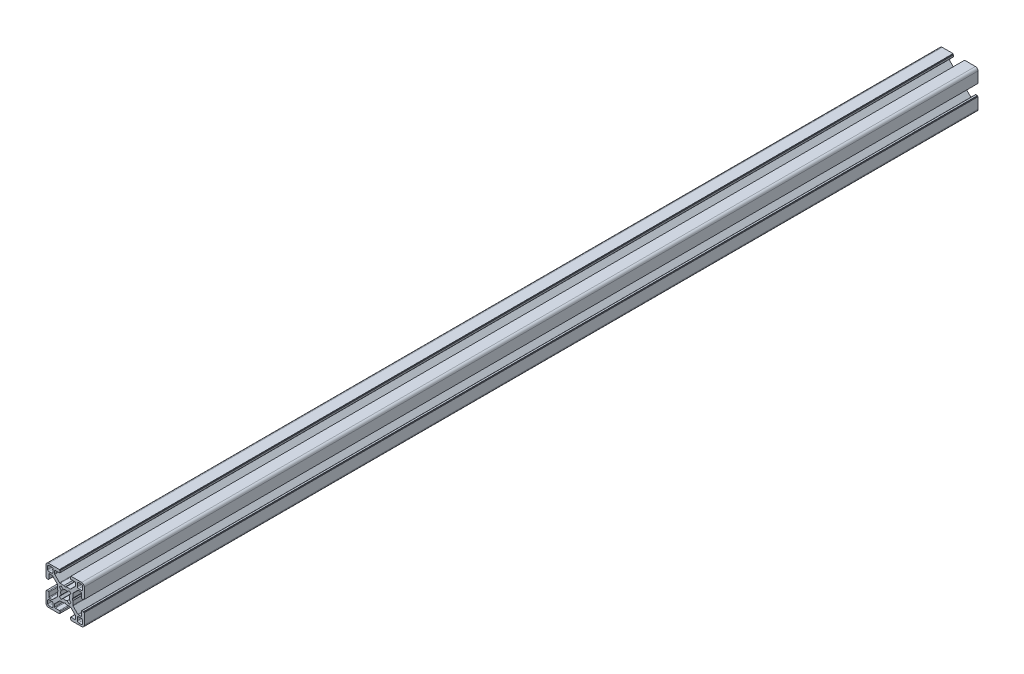
from build123d import *

# Parameters (mm, degrees)
BOSS_EXTRUDE1_DEPTH = 350
CIRPATTERN1_COUNT   = 4


with BuildPart() as part:
    # Sketch3 → Boss-Extrude1 (new, symmetric)
    with BuildSketch(Plane.XY):
        with BuildLine():
            Line((-4.503841895, 3.156803476), (-3.14772708, 1.530298739))
            ThreePointArc((-3.14772708, 1.530298739), (-3.410794979, 0.785160882), (-3.5, 0))
            Line((-3.5, 0), (-5.5, 0))
            Line((-5.5, 0), (-6, 0.866025404))
            Line((-6, 0.866025404), (-6, 3.996841995))
            ThreePointArc((-6, 3.996841995), (-6.038060234, 4.188183711), (-6.146446609, 4.350395385))
            Line((-6.146446609, 4.350395385), (-9.917104615, 8.121053391))
            ThreePointArc((-9.917104615, 8.121053391), (-10.079316289, 8.229439766), (-10.270658005, 8.2675))
            Line((-10.270658005, 8.2675), (-12.29, 8.2675))
            ThreePointArc((-12.29, 8.2675), (-12.643553391, 8.121053391), (-12.79, 7.7675))
            Line((-12.79, 7.7675), (-12.79, 4.5))
            ThreePointArc((-12.79, 4.5), (-12.936446609, 4.146446609), (-13.29, 4))
            Line((-13.29, 4), (-14.5, 4))
            Line((-14.5, 4), (-14.5, 4.5))
            Line((-14.5, 4.5), (-15, 4.5))
            Line((-15, 4.5), (-15, 12.968))
            ThreePointArc((-15, 12.968), (-14.404840979, 14.404840979), (-12.968, 15))
            Line((-12.968, 15), (-4.5, 15))
            Line((-4.5, 15), (-4.5, 14.5))
            Line((-4.5, 14.5), (-4, 14.5))
            Line((-4, 14.5), (-4, 13.29))
            ThreePointArc((-4, 13.29), (-4.146446609, 12.936446609), (-4.5, 12.79))
            Line((-4.5, 12.79), (-7.7675, 12.79))
            ThreePointArc((-7.7675, 12.79), (-8.121053391, 12.643553391), (-8.2675, 12.29))
            Line((-8.2675, 12.29), (-8.2675, 10.270658005))
            ThreePointArc((-8.2675, 10.270658005), (-8.229439766, 10.079316289), (-8.121053391, 9.917104615))
            Line((-8.121053391, 9.917104615), (-4.350395385, 6.146446609))
            ThreePointArc((-4.350395385, 6.146446609), (-4.188183711, 6.038060234), (-3.996841995, 6))
            Line((-3.996841995, 6), (-0.866025404, 6))
            Line((-0.866025404, 6), (0, 5.5))
            Line((0, 5.5), (0, 3.5))
            ThreePointArc((0, 3.5), (-0.785160882, 3.410794979), (-1.530298739, 3.14772708))
            Line((-1.530298739, 3.14772708), (-3.156803476, 4.503841895))
            ThreePointArc((-3.156803476, 4.503841895), (-3.889087297, 3.889087297), (-4.503841895, 3.156803476))
        make_face()
        with BuildLine():
            Line((-12.705, 9.5135), (-10.5135, 9.5135))
            ThreePointArc((-10.5135, 9.5135), (-9.806393219, 9.806393219), (-9.5135, 10.5135))
            Line((-9.5135, 10.5135), (-9.5135, 12.705))
            ThreePointArc((-9.5135, 12.705), (-9.806393219, 13.412106781), (-10.5135, 13.705))
            Line((-10.5135, 13.705), (-12.705, 13.705))
            ThreePointArc((-12.705, 13.705), (-13.412106781, 13.412106781), (-13.705, 12.705))
            Line((-13.705, 12.705), (-13.705, 10.5135))
            ThreePointArc((-13.705, 10.5135), (-13.412106781, 9.806393219), (-12.705, 9.5135))
        make_face(mode=Mode.SUBTRACT)
    boss_extrude1 = extrude(amount=BOSS_EXTRUDE1_DEPTH, both=True)

    # CirPattern1: Boss-Extrude1 ×4 about axis
    cirpattern1_axis = Axis((0, 0, 76.2), (0, 0, -1))
    for i in range(1, CIRPATTERN1_COUNT):
        add(boss_extrude1.rotate(cirpattern1_axis, i * 360 / CIRPATTERN1_COUNT))


solid = part.part
